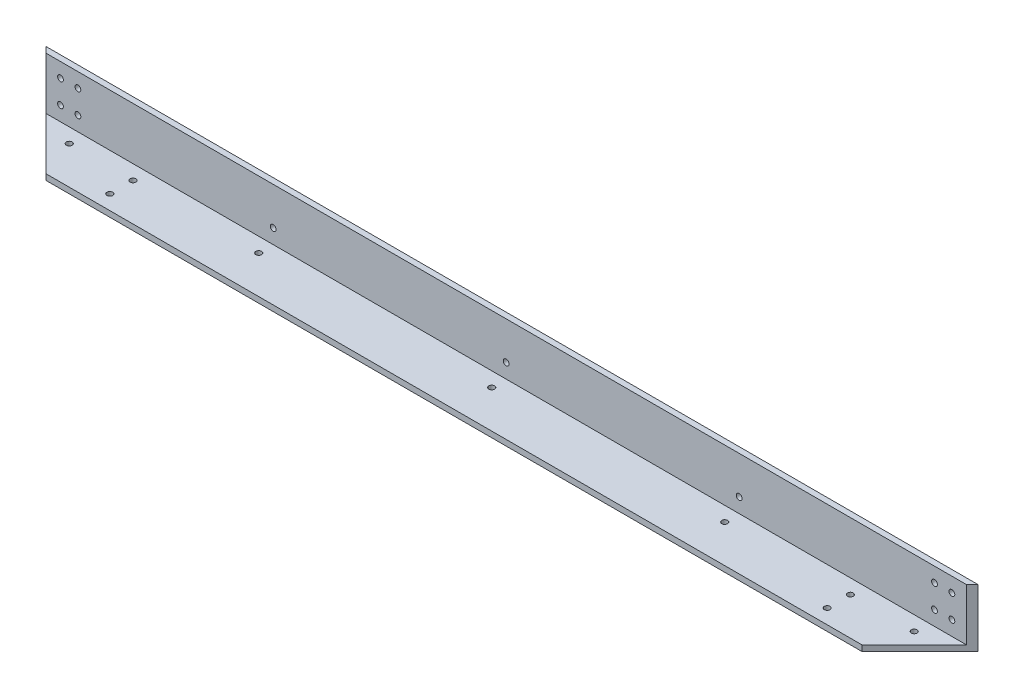
from build123d import *

# Parameters (mm, degrees)
BOSS_EXTRUDE1_DEPTH           = 510
CHAMFER6_SIZE                 = 31.75
CHAMFER7_SIZE                 = 31.75
TOPHOLES_SKETCH3_R            = 1.5875
TOPHOLES_CUT_EXTRUDE2_DEPTH   = 512.785690622
FRONTHOLES_SKETCH4_R          = 1.5875
FRONTHOLES_CUT_EXTRUDE3_DEPTH = 512.785690622


with BuildPart() as part:
    # Sketch1 → Boss-Extrude1 (new body)
    with BuildSketch(Plane(origin=(0, 0, 0), x_dir=(0, 0, -1), z_dir=(1, 0, 0))):
        Polygon((0, 0), (-31.75, 0), (-31.75, 3.175), (-3.175, 3.175), (-3.175, 31.75), (0, 31.75), align=None)
    extrude(amount=BOSS_EXTRUDE1_DEPTH)

    # Chamfer6
    chamfer6_edges = [part.edges().sort_by_distance(p)[0] for p in [
        (510, 1.5875, 31.75),
    ]]
    chamfer(chamfer6_edges, length=CHAMFER6_SIZE - 0.0001)  # a hair under: the kernel refuses the full size

    # Chamfer7
    chamfer7_edges = [part.edges().sort_by_distance(p)[0] for p in [
        (0, 1.5875, 31.75),
    ]]
    chamfer(chamfer7_edges, length=CHAMFER7_SIZE - 0.0001)  # a hair under: the kernel refuses the full size

    # TopHoles-Sketch3 → TopHoles-Cut-Extrude2 (cut, through all)
    with BuildSketch(Plane(origin=(0, 3.175, 0), x_dir=(1, 0, 0), z_dir=(0, 1, 0))):
        with Locations(Location((58.7375, -23.8125, 0), (0, 0, 270))):
            Circle(TOPHOLES_SKETCH3_R)
        with Locations(Location((451.2625, -23.8125, 0), (0, 0, 270))):
            Circle(TOPHOLES_SKETCH3_R)
        with Locations(Location((451.2625, -11.1125, 0), (0, 0, 270))):
            Circle(TOPHOLES_SKETCH3_R)
        with Locations(Location((58.7375, -11.1125, 0), (0, 0, 270))):
            Circle(TOPHOLES_SKETCH3_R)
        with Locations(Location((486.1875, -11.1125, 0), (0, 0, 270))):
            Circle(TOPHOLES_SKETCH3_R)
        with Locations(Location((23.8125, -11.1125, 0), (0, 0, 270))):
            Circle(TOPHOLES_SKETCH3_R)
        with Locations(Location((127.5, -11.1125, 0), (0, 0, 270))):
            Circle(TOPHOLES_SKETCH3_R)
        with Locations(Location((255, -11.1125, 0), (0, 0, 270))):
            Circle(TOPHOLES_SKETCH3_R)
        with Locations(Location((382.5, -11.1125, 0), (0, 0, 270))):
            Circle(TOPHOLES_SKETCH3_R)
    extrude(amount=-TOPHOLES_CUT_EXTRUDE2_DEPTH, mode=Mode.SUBTRACT)

    # FrontHoles-Sketch4 → FrontHoles-Cut-Extrude3 (cut, through all)
    with BuildSketch(Plane.XY.offset(3.175)):
        with Locations((11.1125, 23.8125)):
            Circle(FRONTHOLES_SKETCH4_R)
        with Locations((489.3625, 23.8125)):
            Circle(FRONTHOLES_SKETCH4_R)
        with Locations((20.6375, 23.8125)):
            Circle(FRONTHOLES_SKETCH4_R)
        with Locations((498.8875, 23.8125)):
            Circle(FRONTHOLES_SKETCH4_R)
        with Locations((11.1125, 11.1125)):
            Circle(FRONTHOLES_SKETCH4_R)
        with Locations((20.6375, 11.1125)):
            Circle(FRONTHOLES_SKETCH4_R)
        with Locations((489.3625, 11.1125)):
            Circle(FRONTHOLES_SKETCH4_R)
        with Locations((498.8875, 11.1125)):
            Circle(FRONTHOLES_SKETCH4_R)
        with Locations((127.5, 11.1125)):
            Circle(FRONTHOLES_SKETCH4_R)
        with Locations((255, 11.1125)):
            Circle(FRONTHOLES_SKETCH4_R)
        with Locations((382.5, 11.1125)):
            Circle(FRONTHOLES_SKETCH4_R)
    extrude(amount=-FRONTHOLES_CUT_EXTRUDE3_DEPTH, mode=Mode.SUBTRACT)


solid = part.part
